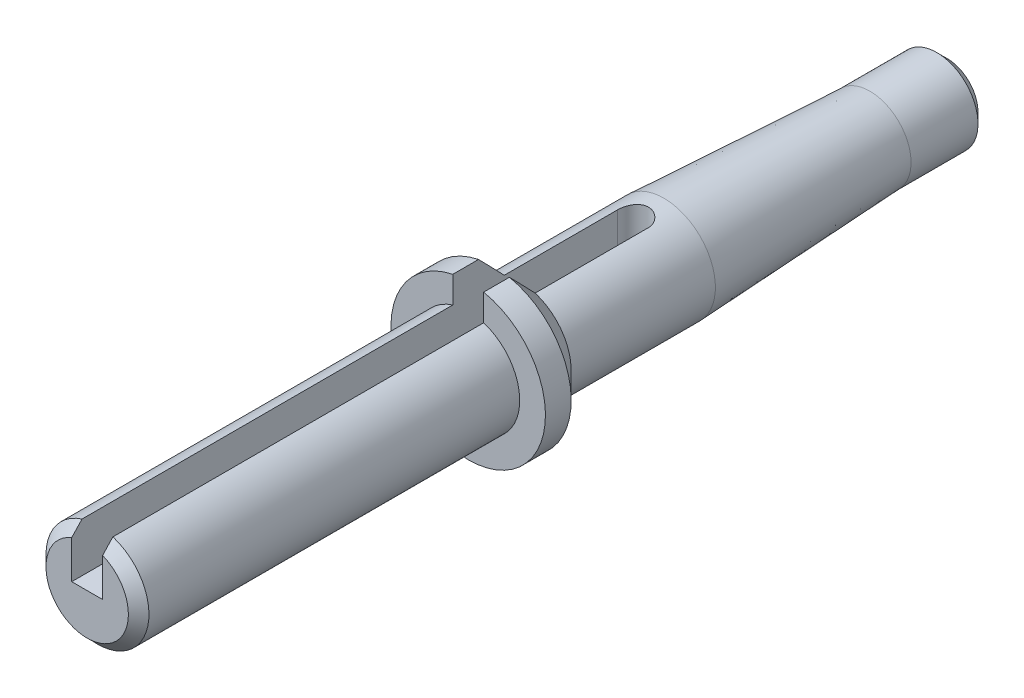
from build123d import *

# Parameters (mm, degrees)
SKETCH1_R           = 5
BOSS_EXTRUDE1_DEPTH = 16.5
SKETCH2_R           = 7.5
BOSS_EXTRUDE2_DEPTH = 39.5
SKETCH16_W          = 3
SKETCH16_H          = 64.5
CHAMFER_1_SIZE      = 2.5
SKETCH9_R           = 5
EXTRUDE_1_DEPTH     = 20
EXTRUDE_1_TAPER     = 2.8625
SKETCH_1_R          = 3.999966835
EXTRUDE_2_DEPTH     = 7.5
CHAMFER_2_SIZE      = 1
CUT_EXTRUDE_1_DEPTH = 10


with BuildPart() as part:
    # Sketch1 → Boss-Extrude1 (new body)
    with BuildSketch(Plane.XY):
        Circle(SKETCH1_R)
    extrude(amount=BOSS_EXTRUDE1_DEPTH)

    # Sketch2 → Boss-Extrude2 (add)
    with BuildSketch(Plane.XY.offset(16.5)):
        Circle(SKETCH2_R)
    extrude(amount=BOSS_EXTRUDE2_DEPTH)

    # Sketch16 → Cut-Revolve1 (revolve, cut)
    with BuildSketch(Plane(origin=(0, 0, 0), x_dir=(1, 0, 0), z_dir=(0, 1, 0)), mode=Mode.PRIVATE) as cut_revolve1_sk:
        with Locations((6.5, -51.25)):
            Rectangle(SKETCH16_W, SKETCH16_H)
    revolve(cut_revolve1_sk.sketch.rotate(Axis((0, 0, 56), (0, 0, -1)), 180), axis=Axis((0, 0, 56), (0, 0, -1)), mode=Mode.SUBTRACT)

    # Фаска1
    chamfer_1_edges = [part.edges().sort_by_distance(p)[0] for p in [
        (-5, 0, 16.5),
    ]]
    chamfer(chamfer_1_edges, length=CHAMFER_1_SIZE - 0.0001)  # a hair under: the kernel refuses the full size

    # Sketch9 → Бобышка-Вытянуть1 (add)
    with BuildSketch(Plane(origin=(0, 0, 0), x_dir=(-1, 0, 0), z_dir=(0, 0, -1))):
        Circle(SKETCH9_R)
    extrude(amount=EXTRUDE_1_DEPTH, taper=EXTRUDE_1_TAPER)

    # Эскиз1 → Бобышка-Вытянуть2 (add)
    with BuildSketch(Plane(origin=(0, 0, -20), x_dir=(-1, 0, 0), z_dir=(0, 0, -1))):
        Circle(SKETCH_1_R)
    extrude(amount=EXTRUDE_2_DEPTH)

    # Фаска2
    chamfer_2_edges = [part.edges().sort_by_distance(p)[0] for p in [
        (5, 0, 56),
        (3.999966835, 0, -27.5),
    ]]
    chamfer(chamfer_2_edges, length=CHAMFER_2_SIZE)

    # Sketch38 → Вырез-Вытянуть1 (cut)
    with BuildSketch(Plane(origin=(0, 0, 0), x_dir=(1, 0, 0), z_dir=(0, 1, 0))):
        with BuildLine():
            Line((-1.5, -3), (-1.5, -67.243921767))
            ThreePointArc((-1.5, -67.243921767), (0, -68.743921767), (1.5, -67.243921767))
            Line((1.5, -67.243921767), (1.5, -3))
            ThreePointArc((1.5, -3), (0, -1.5), (-1.5, -3))
        make_face()
    extrude(amount=CUT_EXTRUDE_1_DEPTH, mode=Mode.SUBTRACT)


solid = part.part
